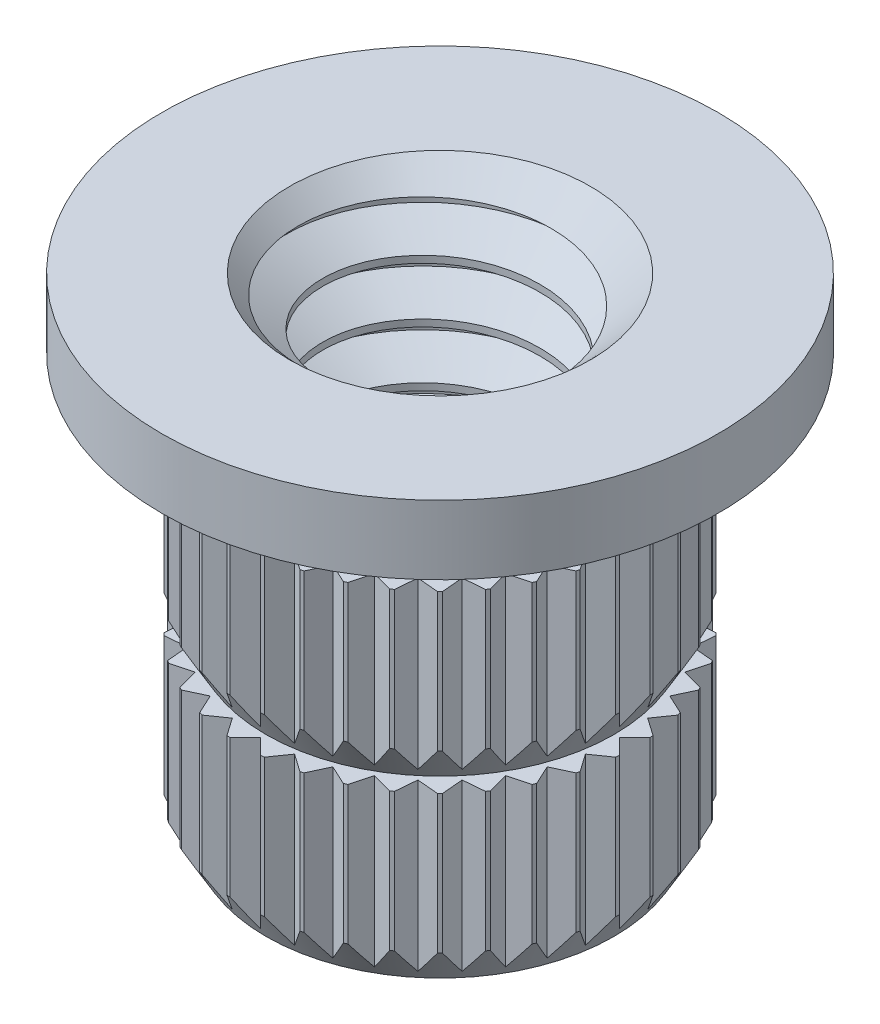
from build123d import *

# Parameters (mm, degrees)
SKETCH1_R         = 2.5019
EXTRUDE1_DEPTH    = 7.0104
EXTRUDE2_START    = -1.9812
SKETCH1_4_R       = 2.8067
EXTRUDE2_DEPTH    = 1.986671
SKETCH1_3_R       = 4.0005
EXTRUDE3_DEPTH    = 0.9906
SKETCH2_R         = 2.8067
EXTRUDE4_DEPTH    = 0.527929
EXTRUDE4_TAPER    = 30
SKETCH8_R         = 1.567244252
EXTRUDE6_DEPTH    = 7.0104
CHAMFER1_SIZE     = 0.5953125
CUT_SWEEP1_PITCH  = 0.79375
EXTRUDE7_DEPTH    = 9.261113348
CIRPATTERN1_COUNT = 36


with BuildPart() as part:
    # Sketch1 → Extrude1 (new body)
    with BuildSketch(Plane(origin=(0, 0, 0), x_dir=(1, 0, 0), z_dir=(0, 1, 0))):
        with Locations(Location((0, 0, 0), (0, 0, 270))):
            Circle(SKETCH1_R)
    extrude(amount=-EXTRUDE1_DEPTH)

    # Sketch1<4> → Extrude2 (add)
    with BuildSketch(Plane(origin=(0, 0, 0), x_dir=(1, 0, 0), z_dir=(0, 1, 0)).offset(EXTRUDE2_START)):
        with Locations(Location((0, 0, 0), (0, 0, 270))):
            Circle(SKETCH1_4_R)
    extrude(amount=-EXTRUDE2_DEPTH)

    # Sketch1<3> → Extrude3 (add)
    with BuildSketch(Plane(origin=(0, 0, 0), x_dir=(1, 0, 0), z_dir=(0, 1, 0))):
        with Locations(Location((0, 0, 0), (0, 0, 270))):
            Circle(SKETCH1_3_R)
    extrude(amount=-EXTRUDE3_DEPTH)

    # Sketch2 → Extrude4 (add)
    with BuildSketch(Plane.XZ.offset(3.967870914)):
        with Locations(Location((0, 0, 0), (0, 0, 90))):
            Circle(SKETCH2_R)
    extrude(amount=EXTRUDE4_DEPTH, taper=EXTRUDE4_TAPER)

    # Sketch5 → Revolve1 (revolve)
    with BuildSketch(Plane.XY):
        Polygon((-2.5019, -7.0104), (-2.8067, -6.482470914), (-2.8067, -4.4958), (-2.5019, -4.4958), (-2.5019, -6.482470914), align=None)
    revolve(axis=Axis((0, 0, 0), (0, -1, 0)))

    # Sketch8 → Extrude6 (cut)
    with BuildSketch(Plane(origin=(0, 0, 0), x_dir=(1, 0, 0), z_dir=(0, 1, 0))):
        with Locations(Location((0, 0, 0), (0, 0, 270))):
            Circle(SKETCH8_R)
    extrude(amount=-EXTRUDE6_DEPTH, mode=Mode.SUBTRACT)

    # Chamfer1
    chamfer1_edges = [part.edges().sort_by_distance(p)[0] for p in [
        (0, -7.0104, -1.567244252),
        (0, 0, -1.567244252),
    ]]
    chamfer(chamfer1_edges, length=CHAMFER1_SIZE)

    # Cut-Sweep1: the profile of Sketch7 screwed along a right-hand helix of 19.885096 turns, 8 arcs to a turn; built about Z, then put on its axis
    cut_sweep1_z = Axis((0, 0, 0), (0, 0, 1))
    cut_sweep1_corners = [(2.0828, 0, -0.396875), (2.0828, 0, -0.29765625), (1.524281273, 0, 0.024804688), (1.524281273, 0, -0.719335937)]
    with BuildLine(mode=Mode.PRIVATE) as cut_sweep1_profile:
        Line(cut_sweep1_corners[0], cut_sweep1_corners[1])
        Line(cut_sweep1_corners[1], cut_sweep1_corners[2])
        Line(cut_sweep1_corners[2], cut_sweep1_corners[3])
        Line(cut_sweep1_corners[3], cut_sweep1_corners[0])
    cut_sweep1_cap = Face(cut_sweep1_profile.wire())
    cut_sweep1_turn_angles = [0, 22.5, 45, 67.5, 90, 112.5, 135, 157.5, 180, 202.5, 225, 247.5, 270, 292.5, 315, 337.5, 360]
    cut_sweep1_turn_weights = [1, 0.9238795325112867, 1, 0.9238795325112867, 1, 0.9238795325112867, 1, 0.9238795325112867, 1, 0.9238795325112867, 1, 0.9238795325112867, 1, 0.9238795325112867, 1, 0.9238795325112867, 1]
    cut_sweep1_turn_rails = [Edge.make_bspline([Vector(p[0], p[1], 0).rotate(cut_sweep1_z, cut_sweep1_turn_angles[k]) / cut_sweep1_turn_weights[k] + Vector(0, 0, p[2] + CUT_SWEEP1_PITCH * cut_sweep1_turn_angles[k] / 360) for k in range(17)], [0, 0, 0, 1, 1, 2, 2, 3, 3, 4, 4, 5, 5, 6, 6, 7, 7, 8, 8, 8], 2, cut_sweep1_turn_weights) for p in cut_sweep1_corners]
    cut_sweep1_turn_sides = [Face.make_surface_from_curves(cut_sweep1_turn_rails[p[0]], cut_sweep1_turn_rails[p[1]]) for p in [(0, 1), (1, 2), (2, 3), (3, 0)]]
    cut_sweep1_last_angles = [6840, 6862.5, 6885, 6907.5, 6930, 6952.5, 6975, 6997.5, 7020, 7042.5, 7065, 7087.5, 7110, 7132.5, 7155, 7156.817368468, 7158.634736936]
    cut_sweep1_last_weights = [1, 0.9238795325112867, 1, 0.9238795325112867, 1, 0.9238795325112867, 1, 0.9238795325112867, 1, 0.9238795325112867, 1, 0.9238795325112867, 1, 0.9238795325112867, 1, 0.9994969926808893, 1]
    cut_sweep1_last_rails = [Edge.make_bspline([Vector(p[0], p[1], 0).rotate(cut_sweep1_z, cut_sweep1_last_angles[k]) / cut_sweep1_last_weights[k] + Vector(0, 0, p[2] + CUT_SWEEP1_PITCH * cut_sweep1_last_angles[k] / 360) for k in range(17)], [0, 0, 0, 1, 1, 2, 2, 3, 3, 4, 4, 5, 5, 6, 6, 7, 7, 8, 8, 8], 2, cut_sweep1_last_weights) for p in cut_sweep1_corners]
    cut_sweep1_last_sides = [Face.make_surface_from_curves(cut_sweep1_last_rails[p[0]], cut_sweep1_last_rails[p[1]]) for p in [(0, 1), (1, 2), (2, 3), (3, 0)]]
    cut_sweep1 = Plane(origin=(0, 0, 0), x_dir=(-1, 0, 0), z_dir=(0, -1, 0)) * Solid(Shell([*[p.moved(Location((0, 0, CUT_SWEEP1_PITCH * i))) for i in range(19) for p in cut_sweep1_turn_sides], *cut_sweep1_last_sides, cut_sweep1_cap, cut_sweep1_cap.rotate(cut_sweep1_z, 7158.634736936).moved(Location((0, 0, CUT_SWEEP1_PITCH * 7158.634736936 / 360)))]))
    add(cut_sweep1, mode=Mode.SUBTRACT)

    # Sketch10 → Extrude7 (cut, through all)
    with BuildSketch(Plane.XZ.offset(0.9906)):
        Polygon((0, 2.5781), (-0.2286, 2.8067), (0.2286, 2.8067), align=None)
    extrude7 = extrude(amount=EXTRUDE7_DEPTH, mode=Mode.SUBTRACT)

    # CirPattern1: Extrude7 ×36 about axis
    cirpattern1_axis = Axis((0, 0, 0), (0, 1, 0))
    for i in range(1, CIRPATTERN1_COUNT):
        add(extrude7.rotate(cirpattern1_axis, i * 360 / CIRPATTERN1_COUNT), mode=Mode.SUBTRACT)


solid = part.part
